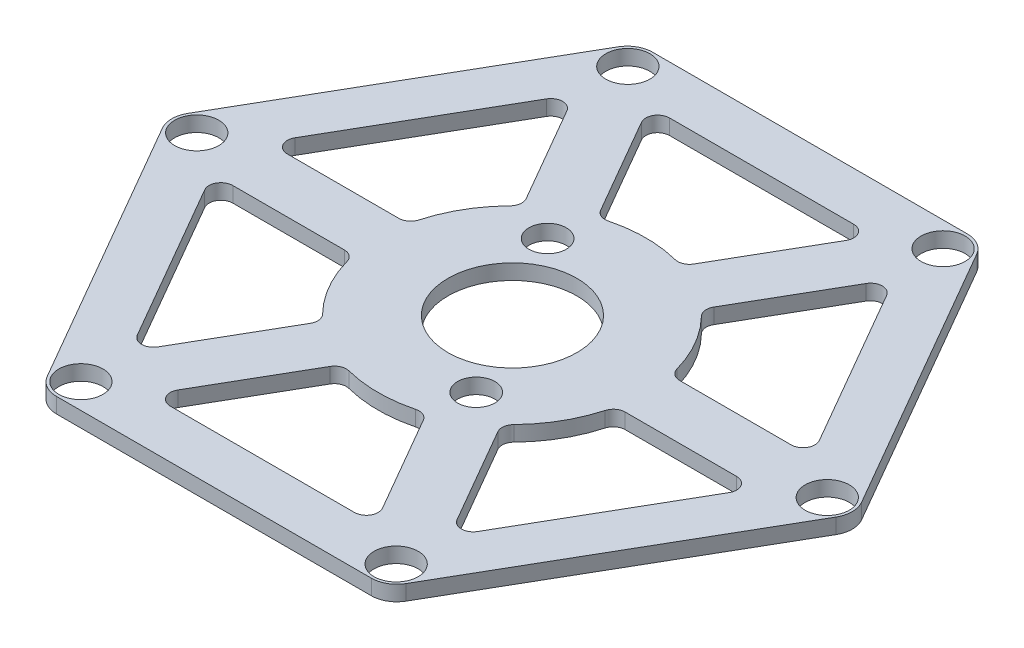
from build123d import *

# Parameters (mm, degrees)
SKETCH1_R           = 2.6
SKETCH1_R_2         = 2.2
SKETCH1_R_3         = 7.6
BOSS_EXTRUDE1_DEPTH = 1.8
FILLET1_R           = 3
FILLET2_R           = 1.4
SCALE1_SCALE        = 1.15


with BuildPart() as part:
    # Sketch1 → Boss-Extrude1 (new body)
    with BuildSketch(Plane(origin=(0, 0, 0), x_dir=(1, 0, 0), z_dir=(0, 1, 0))):
        Polygon((20.3, 35.160631394), (-20.3, 35.160631394), (-40.6, 0), (-20.3, -35.160631394), (20.3, -35.160631394), (40.6, 0), align=None)
        with Locations((-18.636201283, -32.21652123)):
            Circle(SKETCH1_R, mode=Mode.SUBTRACT)
        with Locations((18.582225165, -32.247684356)):
            Circle(SKETCH1_R, mode=Mode.SUBTRACT)
        with Locations((37.218426448, -0.031163126)):
            Circle(SKETCH1_R, mode=Mode.SUBTRACT)
        with Locations((-37.218426448, 0.031163126)):
            Circle(SKETCH1_R, mode=Mode.SUBTRACT)
        with BuildLine():
            Line((-32.142053523, 3.218057696), (-18.857946477, 26.226806032))
            Line((-18.857946477, 26.226806032), (-10.521325069, 11.78735419))
            ThreePointArc((-10.521325069, 11.78735419), (-13.68320138, 7.9), (-15.468810706, 3.218057696))
            Line((-15.468810706, 3.218057696), (-32.142053523, 3.218057696))
        make_face(mode=Mode.SUBTRACT)
        with BuildLine():
            Line((-18.857946477, -26.226806032), (-32.142053523, -3.218057696))
            Line((-32.142053523, -3.218057696), (-15.468810706, -3.218057696))
            ThreePointArc((-15.468810706, -3.218057696), (-13.68320138, -7.9), (-10.521325069, -11.78735419))
            Line((-10.521325069, -11.78735419), (-18.857946477, -26.226806032))
        make_face(mode=Mode.SUBTRACT)
        with BuildLine():
            Line((13.284107046, -29.444863729), (-13.284107046, -29.444863729))
            Line((-13.284107046, -29.444863729), (-4.947485637, -15.005411886))
            ThreePointArc((-4.947485637, -15.005411886), (0, -15.8), (4.947485637, -15.005411886))
            Line((4.947485637, -15.005411886), (13.284107046, -29.444863729))
        make_face(mode=Mode.SUBTRACT)
        with BuildLine():
            Line((32.142053523, -3.218057696), (18.857946477, -26.226806032))
            Line((18.857946477, -26.226806032), (10.521325069, -11.78735419))
            ThreePointArc((10.521325069, -11.78735419), (13.68320138, -7.9), (15.468810706, -3.218057696))
            Line((15.468810706, -3.218057696), (32.142053523, -3.218057696))
        make_face(mode=Mode.SUBTRACT)
        with BuildLine():
            Line((18.857946477, 26.226806032), (32.142053523, 3.218057696))
            Line((32.142053523, 3.218057696), (15.468810706, 3.218057696))
            ThreePointArc((15.468810706, 3.218057696), (13.68320138, 7.9), (10.521325069, 11.78735419))
            Line((10.521325069, 11.78735419), (18.857946477, 26.226806032))
        make_face(mode=Mode.SUBTRACT)
        with BuildLine():
            Line((-13.284107046, 29.444863729), (13.284107046, 29.444863729))
            Line((13.284107046, 29.444863729), (4.947485637, 15.005411886))
            ThreePointArc((4.947485637, 15.005411886), (0, 15.8), (-4.947485637, 15.005411886))
            Line((-4.947485637, 15.005411886), (-13.284107046, 29.444863729))
        make_face(mode=Mode.SUBTRACT)
        with Locations((-18.582225165, 32.247684356)):
            Circle(SKETCH1_R, mode=Mode.SUBTRACT)
        with Locations((18.636201283, 32.21652123)):
            Circle(SKETCH1_R, mode=Mode.SUBTRACT)
        with Locations((5.763168727, -9.982101048)):
            Circle(SKETCH1_R_2, mode=Mode.SUBTRACT)
        with Locations((-5.736740168, 9.936325441)):
            Circle(SKETCH1_R_2, mode=Mode.SUBTRACT)
        with Locations((0.052857117, 0)):
            Circle(SKETCH1_R_3, mode=Mode.SUBTRACT)
    extrude(amount=BOSS_EXTRUDE1_DEPTH)

    # Fillet1
    fillet1_edges = [part.edges().sort_by_distance(p)[0] for p in [
        (-40.6, 0.9, 0),
        (-20.3, 0.9, 35.160631394),
        (20.3, 0.9, 35.160631394),
        (40.6, 0.9, 0),
        (20.3, 0.9, -35.160631394),
        (-20.3, 0.9, -35.160631394),
    ]]
    fillet(fillet1_edges, radius=FILLET1_R)

    # Fillet2
    fillet2_edges = [part.edges().sort_by_distance(p)[0] for p in [
        (-32.142053523, 0.9, 3.218057696),
        (-15.468810706, 0.9, 3.218057696),
        (-10.521325069, 0.9, 11.78735419),
        (-18.857946477, 0.9, 26.226806032),
        (-13.284107046, 0.9, 29.444863729),
        (13.284107046, 0.9, 29.444863729),
        (-4.947485637, 0.9, 15.005411886),
        (4.947485637, 0.9, 15.005411886),
        (18.857946477, 0.9, 26.226806032),
        (10.521325069, 0.9, 11.78735419),
        (15.468810706, 0.9, 3.218057696),
        (32.142053523, 0.9, 3.218057696),
        (32.142053523, 0.9, -3.218057696),
        (18.857946477, 0.9, -26.226806032),
        (15.468810706, 0.9, -3.218057696),
        (10.521325069, 0.9, -11.78735419),
        (-32.142053523, 0.9, -3.218057696),
        (-15.468810706, 0.9, -3.218057696),
        (-4.947485637, 0.9, -15.005411886),
        (-13.284107046, 0.9, -29.444863729),
        (4.947485637, 0.9, -15.005411886),
        (13.284107046, 0.9, -29.444863729),
        (-10.521325069, 0.9, -11.78735419),
        (-18.857946477, 0.9, -26.226806032),
    ]]
    fillet(fillet2_edges, radius=FILLET2_R)


with BuildPart() as part_1:
    # Scale1: scaled about (-0.004144331, 0.9, -0.000288654)
    add(part.part.scale(SCALE1_SCALE).moved(Location((0.00062165, -0.135, 4.3298e-05))))


solid = part_1.part
